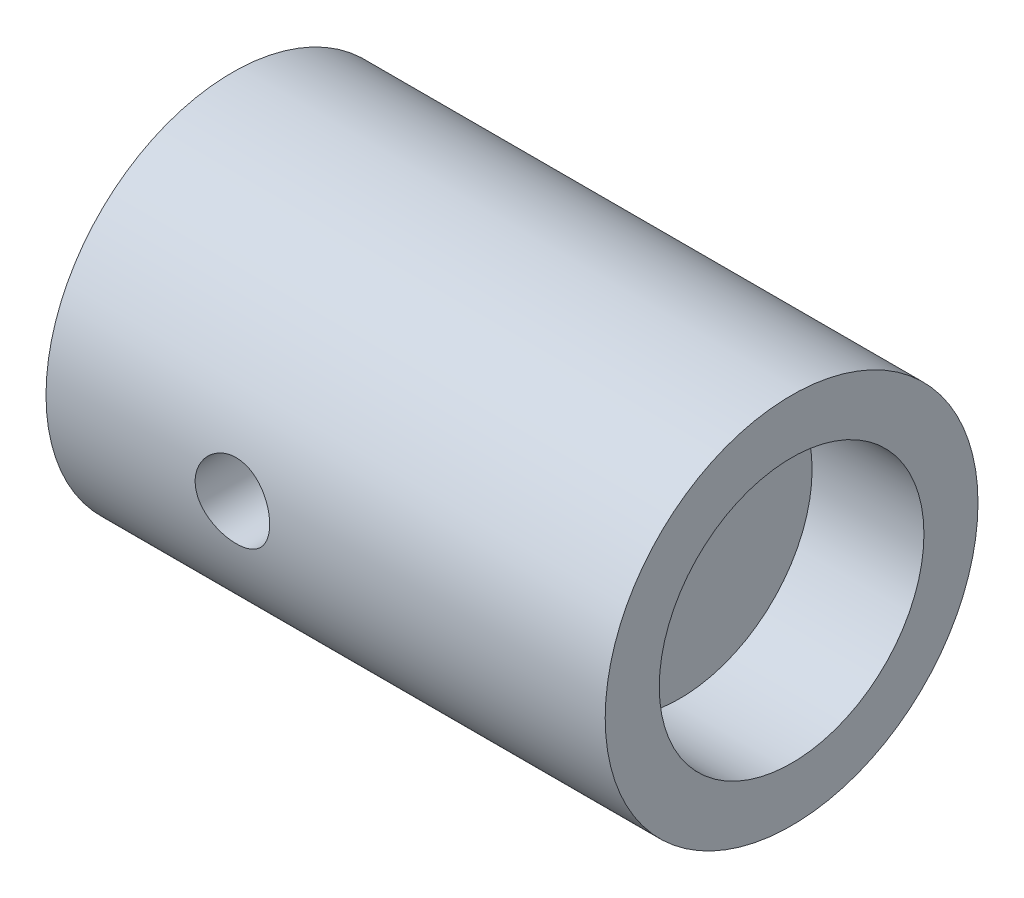
from build123d import *

# Parameters (mm, degrees)
SKETCH_1_R               = 5
EXTRUDE_1_DEPTH          = 15
SKETCH_2_R               = 3.55
CUT_EXTRUDE_1_DEPTH      = 3
SKETCH_3_R               = 3
CUT_EXTRUDE_2_DEPTH      = 10
CUT_EXTRUDE_3_DEPTH      = 5
CUT_EXTRUDE_3_DEPTH_BACK = 5
SKETCH_4_R               = 1


with BuildPart() as part:
    # 草图1 → 凸台-拉伸1 (new body)
    with BuildSketch(Plane(origin=(0, 0, 0), x_dir=(0, 0, -1), z_dir=(1, 0, 0))):
        Circle(SKETCH_1_R)
    extrude(amount=EXTRUDE_1_DEPTH)

    # 草图2 → 切除-拉伸1 (cut)
    with BuildSketch(Plane(origin=(15, 0, 0), x_dir=(0, 0, -1), z_dir=(1, 0, 0))):
        Circle(SKETCH_2_R)
    extrude(amount=-CUT_EXTRUDE_1_DEPTH, mode=Mode.SUBTRACT)

    # 草图3 → 切除-拉伸2 (cut)
    with BuildSketch(Plane.ZY):
        Circle(SKETCH_3_R)
    extrude(amount=-CUT_EXTRUDE_2_DEPTH, mode=Mode.SUBTRACT)

    # 草图4 → 切除-拉伸3 (cut, two sides: drawn at the far end of the back side and taken through both)
    with BuildSketch(Plane.XY.offset(-CUT_EXTRUDE_3_DEPTH_BACK)):
        with Locations((5, 0)):
            Circle(SKETCH_4_R)
    extrude(amount=CUT_EXTRUDE_3_DEPTH + CUT_EXTRUDE_3_DEPTH_BACK, mode=Mode.SUBTRACT)


solid = part.part
